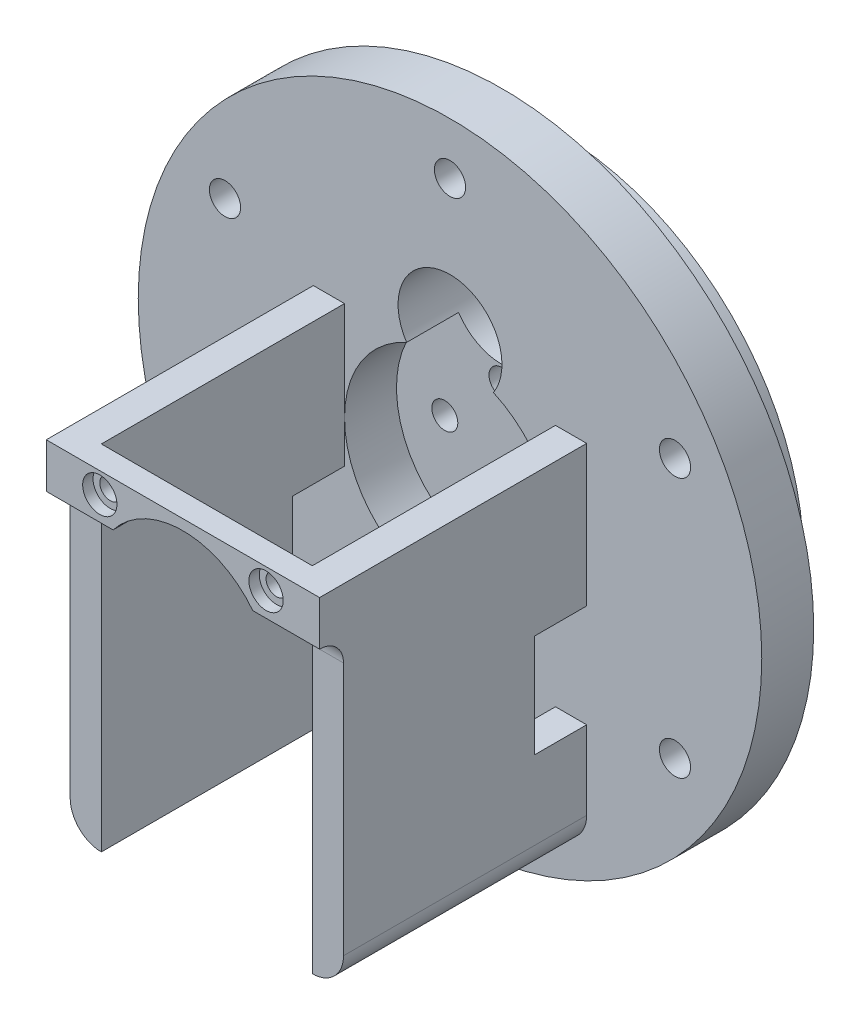
from build123d import *

# Parameters (mm, degrees)
CROQUIS2_R              = 30
SALIENTE_EXTRUIR1_DEPTH = 5
CROQUIS6_R              = 23.5
SALIENTE_EXTRUIR5_DEPTH = 5.5
CROQUIS7_W              = 3
CROQUIS7_H              = 34
SALIENTE_EXTRUIR6_DEPTH = 23.4
REDONDEO1_R             = 3
CROQUIS8_R              = 10.15
CORTAR_EXTRUIR1_DEPTH   = 5
CORTAR_EXTRUIR2_REACH   = 53.054
CROQUIS9_R              = 1.25
CROQUIS10_R             = 1.5
CORTAR_EXTRUIR3_DEPTH   = 3.5
CORTAR_EXTRUIR4_REACH   = 50.452
CROQUIS11_R             = 4.998325146
CORTAR_EXTRUIR5_REACH   = 61.737
CROQUIS12_W             = 5
CROQUIS12_H             = 9.9
CROQUIS13_W             = 26.3
CROQUIS13_H             = 4.3
SALIENTE_EXTRUIR7_DEPTH = 2.3
REDONDEO2_R             = 2.3
CORTAR_EXTRUIR6_DEPTH   = 2.3
CROQUIS16_R             = 1
CORTAR_EXTRUIR7_DEPTH   = 2.3
CROQUIS17_R             = 1.65
CORTAR_EXTRUIR8_DEPTH   = 1


with BuildPart() as part:
    # Croquis2 → Saliente-Extruir1 (new body)
    with BuildSketch(Plane.XY):
        Circle(CROQUIS2_R)
    extrude(amount=SALIENTE_EXTRUIR1_DEPTH)

    # Croquis6 → Saliente-Extruir5 (add)
    with BuildSketch(Plane(origin=(0, 0, 0), x_dir=(-1, 0, 0), z_dir=(0, 0, -1))):
        Circle(CROQUIS6_R)
    extrude(amount=SALIENTE_EXTRUIR5_DEPTH)

    # Croquis7 → Saliente-Extruir6 (add)
    with BuildSketch(Plane.XY.offset(5)):
        with Locations((-11.65, -7.5)):
            Rectangle(CROQUIS7_W, CROQUIS7_H)
        with Locations((11.65, -7.5)):
            Rectangle(CROQUIS7_W, CROQUIS7_H)
    extrude(amount=SALIENTE_EXTRUIR6_DEPTH)

    # Redondeo1
    redondeo1_edges = [part.edges().sort_by_distance(p)[0] for p in [
        (13.15, -24.5, 16.7),
        (-13.15, -24.5, 16.7),
    ]]
    fillet(redondeo1_edges, radius=REDONDEO1_R - 0.0001)  # a hair under: the kernel refuses the full size

    # Croquis8 → Cortar-Extruir1 (cut)
    with BuildSketch(Plane.XY.offset(5)):
        Circle(CROQUIS8_R)
    extrude(amount=-CORTAR_EXTRUIR1_DEPTH, mode=Mode.SUBTRACT)

    # Croquis9 → Cortar-Extruir2 (cut, up to next)
    with BuildSketch(Plane.XY, mode=Mode.PRIVATE) as cortar_extruir2_sk1:
        with Locations((0, 5.5)):
            Circle(CROQUIS9_R)
    cortar_extruir2_tool1 = extrude(cortar_extruir2_sk1.sketch, amount=-CORTAR_EXTRUIR2_REACH, mode=Mode.PRIVATE) & part.part
    # Croquis9 → Cortar-Extruir2 (cut, up to next)
    with BuildSketch(Plane.XY, mode=Mode.PRIVATE) as cortar_extruir2_sk2:
        with Locations((5.5, 0)):
            Circle(CROQUIS9_R)
    cortar_extruir2_tool2 = extrude(cortar_extruir2_sk2.sketch, amount=-CORTAR_EXTRUIR2_REACH, mode=Mode.PRIVATE) & part.part
    # Croquis9 → Cortar-Extruir2 (cut, up to next)
    with BuildSketch(Plane.XY, mode=Mode.PRIVATE) as cortar_extruir2_sk3:
        with Locations((0, -5.5)):
            Circle(CROQUIS9_R)
    cortar_extruir2_tool3 = extrude(cortar_extruir2_sk3.sketch, amount=-CORTAR_EXTRUIR2_REACH, mode=Mode.PRIVATE) & part.part
    # Croquis9 → Cortar-Extruir2 (cut, up to next)
    with BuildSketch(Plane.XY, mode=Mode.PRIVATE) as cortar_extruir2_sk4:
        with Locations((-5.5, 0)):
            Circle(CROQUIS9_R)
    cortar_extruir2_tool4 = extrude(cortar_extruir2_sk4.sketch, amount=-CORTAR_EXTRUIR2_REACH, mode=Mode.PRIVATE) & part.part
    add(cortar_extruir2_tool1.solids().sort_by_distance((0, 5.5, 0))[0], mode=Mode.SUBTRACT)
    add(cortar_extruir2_tool2.solids().sort_by_distance((5.5, 0, 0))[0], mode=Mode.SUBTRACT)
    add(cortar_extruir2_tool3.solids().sort_by_distance((0, -5.5, 0))[0], mode=Mode.SUBTRACT)
    add(cortar_extruir2_tool4.solids().sort_by_distance((-5.5, 0, 0))[0], mode=Mode.SUBTRACT)

    # Croquis10 → Cortar-Extruir3 (cut)
    with BuildSketch(Plane.XY.offset(5)):
        with Locations((21.650635095, -12.5)):
            Circle(CROQUIS10_R)
        with Locations((-21.650635095, -12.5)):
            Circle(CROQUIS10_R)
        with Locations((21.650635095, 12.5)):
            Circle(CROQUIS10_R)
        with Locations((-21.650635095, 12.5)):
            Circle(CROQUIS10_R)
        with Locations((0, 25)):
            Circle(CROQUIS10_R)
    extrude(amount=-CORTAR_EXTRUIR3_DEPTH, mode=Mode.SUBTRACT)

    # Croquis11 → Cortar-Extruir4 (cut, up to next)
    with BuildSketch(Plane.XY.offset(5), mode=Mode.PRIVATE) as cortar_extruir4_sk1:
        with Locations(Location((0, 12, 0), (0, 0, 326.642787388))):
            Circle(CROQUIS11_R)
    cortar_extruir4_tool1 = extrude(cortar_extruir4_sk1.sketch, amount=-CORTAR_EXTRUIR4_REACH, mode=Mode.PRIVATE) & part.part
    add(cortar_extruir4_tool1.solids().sort_by_distance((0, 12, 5))[0], mode=Mode.SUBTRACT)

    # Cortar-Extruir5: up to this face of the body (flat: up to its plane)
    cortar_extruir5_end = Plane(part.part.faces().sort_by_distance((-13.15, -6.00005, 16.7))[0])
    # Croquis12 → Cortar-Extruir5 (cut, up to the picked face)
    with BuildSketch(Plane(origin=(13.15, 0, 0), x_dir=(0, 0, -1), z_dir=(1, 0, 0)), mode=Mode.PRIVATE) as cortar_extruir5_sk1:
        with Locations((-7.5, -9)):
            Rectangle(CROQUIS12_W, CROQUIS12_H)
    cortar_extruir5_tool1 = split(extrude(cortar_extruir5_sk1.sketch, amount=-CORTAR_EXTRUIR5_REACH, mode=Mode.PRIVATE), bisect_by=cortar_extruir5_end, keep=Keep.BOTH, mode=Mode.PRIVATE)
    add(cortar_extruir5_tool1.solids().sort_by(Axis((13.15, -9, 7.5), (-1, 0, 0)))[0], mode=Mode.SUBTRACT)

    # Croquis13 → Saliente-Extruir7 (add)
    with BuildSketch(Plane.XY.offset(28.4)):
        with Locations((0, 7.35)):
            Rectangle(CROQUIS13_W, CROQUIS13_H)
    extrude(amount=SALIENTE_EXTRUIR7_DEPTH)

    # Redondeo2
    redondeo2_edges = [part.edges().sort_by_distance(p)[0] for p in [
        (11.65, 5.2, 28.4),
        (-11.65, 5.2, 28.4),
    ]]
    fillet(redondeo2_edges, radius=REDONDEO2_R - 0.0001)  # a hair under: the kernel refuses the full size

    # Croquis15 → Cortar-Extruir6 (cut)
    with BuildSketch(Plane.XY.offset(30.7)):
        with BuildLine():
            Line((-7.082372484, 4.7), (7.082372484, 4.7))
            ThreePointArc((7.082372484, 4.7), (0, 8.5), (-7.082372484, 4.7))
        make_face()
    extrude(amount=-CORTAR_EXTRUIR6_DEPTH, mode=Mode.SUBTRACT)

    # Croquis16 → Cortar-Extruir7 (cut)
    with BuildSketch(Plane.XY.offset(30.7)):
        with Locations((-8, 7.5)):
            Circle(CROQUIS16_R)
        with Locations((8, 7.5)):
            Circle(CROQUIS16_R)
    extrude(amount=-CORTAR_EXTRUIR7_DEPTH, mode=Mode.SUBTRACT)

    # Croquis17 → Cortar-Extruir8 (cut)
    with BuildSketch(Plane.XY.offset(30.7)):
        with Locations((-8, 7.5)):
            Circle(CROQUIS17_R)
        with Locations((8, 7.5)):
            Circle(CROQUIS17_R)
    extrude(amount=-CORTAR_EXTRUIR8_DEPTH, mode=Mode.SUBTRACT)


solid = part.part
